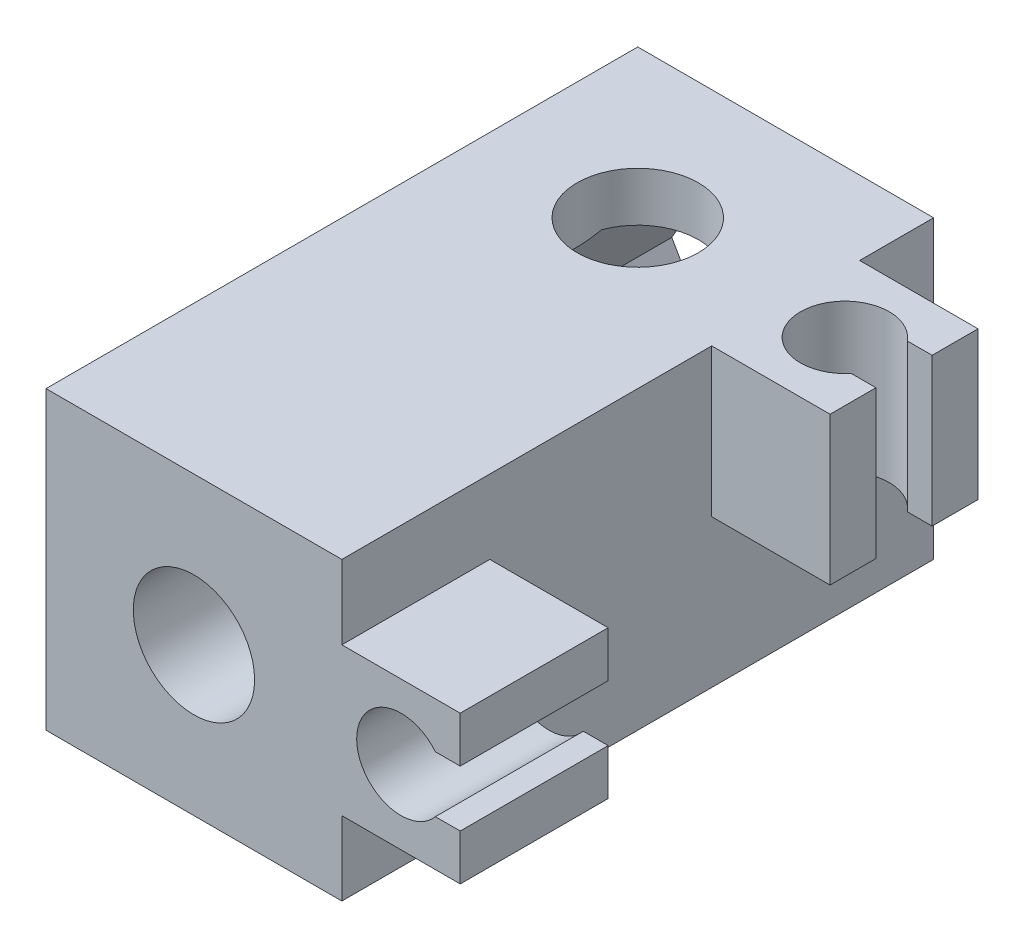
from build123d import *

# Parameters (mm, degrees)
SKETCH1_W           = 20
SKETCH1_H           = 40
BOSS_EXTRUDE1_DEPTH = 20
SKETCH2_R           = 4.1
CUT_EXTRUDE1_DEPTH  = 31
SKETCH3_R           = 4.1
CUT_EXTRUDE2_DEPTH  = 46.82575695
CUT_EXTRUDE3_DEPTH  = 21
BOSS_EXTRUDE2_DEPTH = 10
BOSS_EXTRUDE3_DEPTH = 10


with BuildPart() as part:
    # Sketch1 → Boss-Extrude1 (new body)
    with BuildSketch(Plane(origin=(0, 0, 0), x_dir=(1, 0, 0), z_dir=(0, 1, 0))):
        Rectangle(SKETCH1_W, SKETCH1_H)
    extrude(amount=BOSS_EXTRUDE1_DEPTH)

    # Sketch2 → Cut-Extrude1 (cut, through all)
    with BuildSketch(Plane.XZ):
        with Locations((0, -10)):
            Circle(SKETCH2_R)
    extrude(amount=-CUT_EXTRUDE1_DEPTH, mode=Mode.SUBTRACT)

    # Sketch3 → Cut-Extrude2 (cut, through all)
    with BuildSketch(Plane.XY.offset(20)):
        with Locations((0, 10)):
            Circle(SKETCH3_R)
    extrude(amount=-CUT_EXTRUDE2_DEPTH, mode=Mode.SUBTRACT)

    # Sketch4 → Cut-Extrude3 (cut)
    with BuildSketch(Plane(origin=(0, 0, -20), x_dir=(-1, 0, 0), z_dir=(0, 0, -1))):
        Polygon((-7.7, 10), (-3.85, 3.331604391), (3.85, 3.331604391), (7.7, 10), (3.85, 16.668395609), (-3.85, 16.668395609), align=None)
    extrude(amount=-CUT_EXTRUDE3_DEPTH, mode=Mode.SUBTRACT)

    # Sketch5 → Boss-Extrude2 (add)
    with BuildSketch(Plane(origin=(0, 20, 0), x_dir=(1, 0, 0), z_dir=(0, 1, 0))):
        with BuildLine():
            Line((10, 5), (18, 5))
            Line((18, 5), (18, 8.1))
            Line((18, 8.1), (16.321637353, 8.1))
            ThreePointArc((16.321637353, 8.1), (11, 10), (16.321637353, 11.9))
            Line((16.321637353, 11.9), (18, 11.9))
            Line((18, 11.9), (18, 15))
            Line((18, 15), (10, 15))
            Line((10, 15), (10, 5))
        make_face()
    extrude(amount=-BOSS_EXTRUDE2_DEPTH)

    # Sketch6 → Boss-Extrude3 (add)
    with BuildSketch(Plane.XY.offset(20)):
        with BuildLine():
            Line((10, 5), (18, 5))
            Line((18, 5), (18, 8.1))
            Line((18, 8.1), (16.321637353, 8.1))
            ThreePointArc((16.321637353, 8.1), (11, 10), (16.321637353, 11.9))
            Line((16.321637353, 11.9), (18, 11.9))
            Line((18, 11.9), (18, 15))
            Line((18, 15), (10, 15))
            Line((10, 15), (10, 5))
        make_face()
    extrude(amount=-BOSS_EXTRUDE3_DEPTH)


solid = part.part
